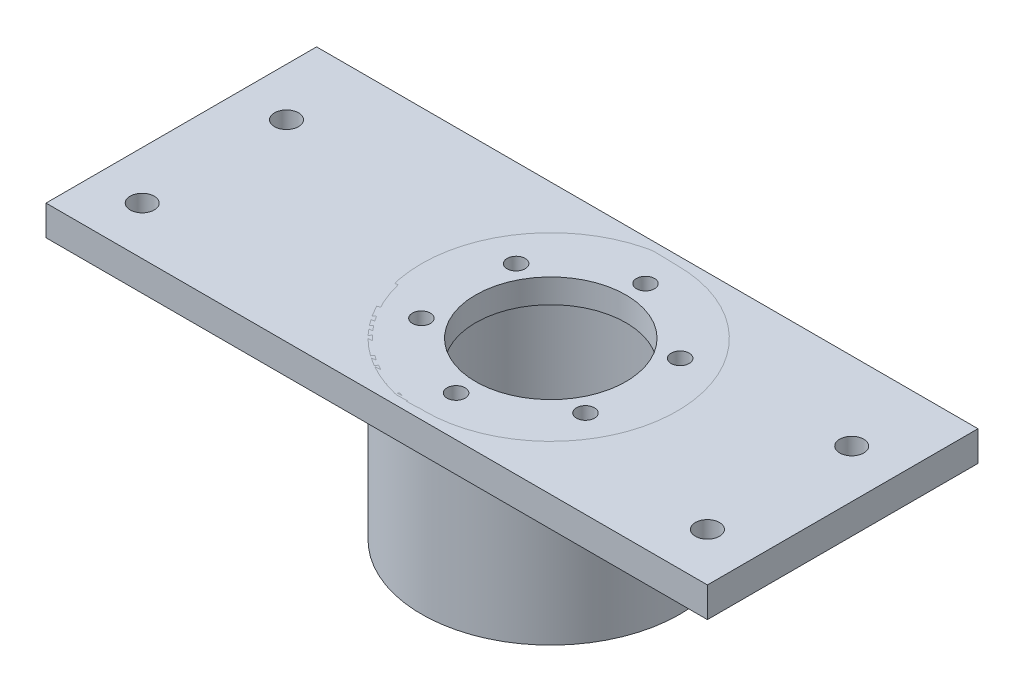
from build123d import *

# Parameters (mm, degrees)
SKETCH1_W                 = 110
SKETCH1_H                 = 45
BOSS_EXTRUDE1_DEPTH       = 5
SKETCH2_R                 = 21
CUT_EXTRUDE1_DEPTH        = 5
MOTOR_MOUNT_START         = -24
MOTOR_MOUNT_OUTLINE_R     = 21.5
MOTOR_MOUNT_OUTLINE_R_2   = 19
MOTOR_MOUNT_DEPTH         = 29
MOTOR_MOUNT_START_2       = 1
MOTOR_MOUNT_2_OUTLINE_R   = 19
MOTOR_MOUNT_2_OUTLINE_R_2 = 1.5
MOTOR_MOUNT_2_OUTLINE_R_3 = 12.5
MOTOR_MOUNT_2_DEPTH       = 4
SKETCH6_R                 = 2
CUT_EXTRUDE2_DEPTH        = 5
SKETCH7_R                 = 2
CUT_EXTRUDE3_DEPTH        = 5


# Read off the part's stored shape, not the designer's step: motor_mount
with BuildPart() as part:
    # Sketch1 → Boss-Extrude1 (new body)
    with BuildSketch(Plane(origin=(0, 0, 0), x_dir=(1, 0, 0), z_dir=(0, 1, 0))):
        with Locations((-6.45, 0)):
            Rectangle(SKETCH1_W, SKETCH1_H)
    extrude(amount=BOSS_EXTRUDE1_DEPTH)

    # Sketch2 → Cut-Extrude1 (cut)
    with BuildSketch(Plane(origin=(0, 5, 0), x_dir=(1, 0, 0), z_dir=(0, 1, 0))):
        with Locations(Location((0, 0, 0), (0, 0, 270))):
            Circle(SKETCH2_R)
    extrude(amount=-CUT_EXTRUDE1_DEPTH, mode=Mode.SUBTRACT)

    # Sketch6 → Cut-Extrude2 (cut)
    with BuildSketch(Plane(origin=(0, 5, 0), x_dir=(1, 0, 0), z_dir=(0, 1, 0))):
        with Locations(Location((40.55, -14.5, 0), (0, 0, 270))):
            Circle(SKETCH6_R)
        with Locations(Location((40.55, 9.5, 0), (0, 0, 270))):
            Circle(SKETCH6_R)
    extrude(amount=-CUT_EXTRUDE2_DEPTH, mode=Mode.SUBTRACT)

    # Sketch7 → Cut-Extrude3 (cut)
    with BuildSketch(Plane(origin=(0, 5, 0), x_dir=(1, 0, 0), z_dir=(0, 1, 0))):
        with Locations(Location((-53.45, -14.5, 0), (0, 0, 270))):
            Circle(SKETCH7_R)
        with Locations(Location((-53.45, 9.5, 0), (0, 0, 270))):
            Circle(SKETCH7_R)
    extrude(amount=-CUT_EXTRUDE3_DEPTH, mode=Mode.SUBTRACT)


with BuildPart() as body_2:
    # motor_mount outline → motor_mount (new body)
    with BuildSketch(Plane(origin=(0, 0, 0), x_dir=(1, 0, 0), z_dir=(0, 1, 0)).offset(MOTOR_MOUNT_START)):
        Circle(MOTOR_MOUNT_OUTLINE_R)
        Circle(MOTOR_MOUNT_OUTLINE_R_2, mode=Mode.SUBTRACT)
    extrude(amount=MOTOR_MOUNT_DEPTH)

    # motor_mount 2 outline → motor_mount 2 (add)
    with BuildSketch(Plane(origin=(0, 0, 0), x_dir=(1, 0, 0), z_dir=(0, 1, 0)).offset(MOTOR_MOUNT_START_2)):
        Circle(MOTOR_MOUNT_2_OUTLINE_R)
        with Locations((-13.63990011, -7.875)):
            Circle(MOTOR_MOUNT_2_OUTLINE_R_2, mode=Mode.SUBTRACT)
        with Locations((0, -15.75)):
            Circle(MOTOR_MOUNT_2_OUTLINE_R_2, mode=Mode.SUBTRACT)
        with Locations((13.63990011, -7.875)):
            Circle(MOTOR_MOUNT_2_OUTLINE_R_2, mode=Mode.SUBTRACT)
        with Locations((-13.63990011, 7.875)):
            Circle(MOTOR_MOUNT_2_OUTLINE_R_2, mode=Mode.SUBTRACT)
        Circle(MOTOR_MOUNT_2_OUTLINE_R_3, mode=Mode.SUBTRACT)
        with Locations((13.63990011, 7.875)):
            Circle(MOTOR_MOUNT_2_OUTLINE_R_2, mode=Mode.SUBTRACT)
        with Locations((0, 15.75)):
            Circle(MOTOR_MOUNT_2_OUTLINE_R_2, mode=Mode.SUBTRACT)
    extrude(amount=MOTOR_MOUNT_2_DEPTH)


solid = Compound([part.part, body_2.part])
